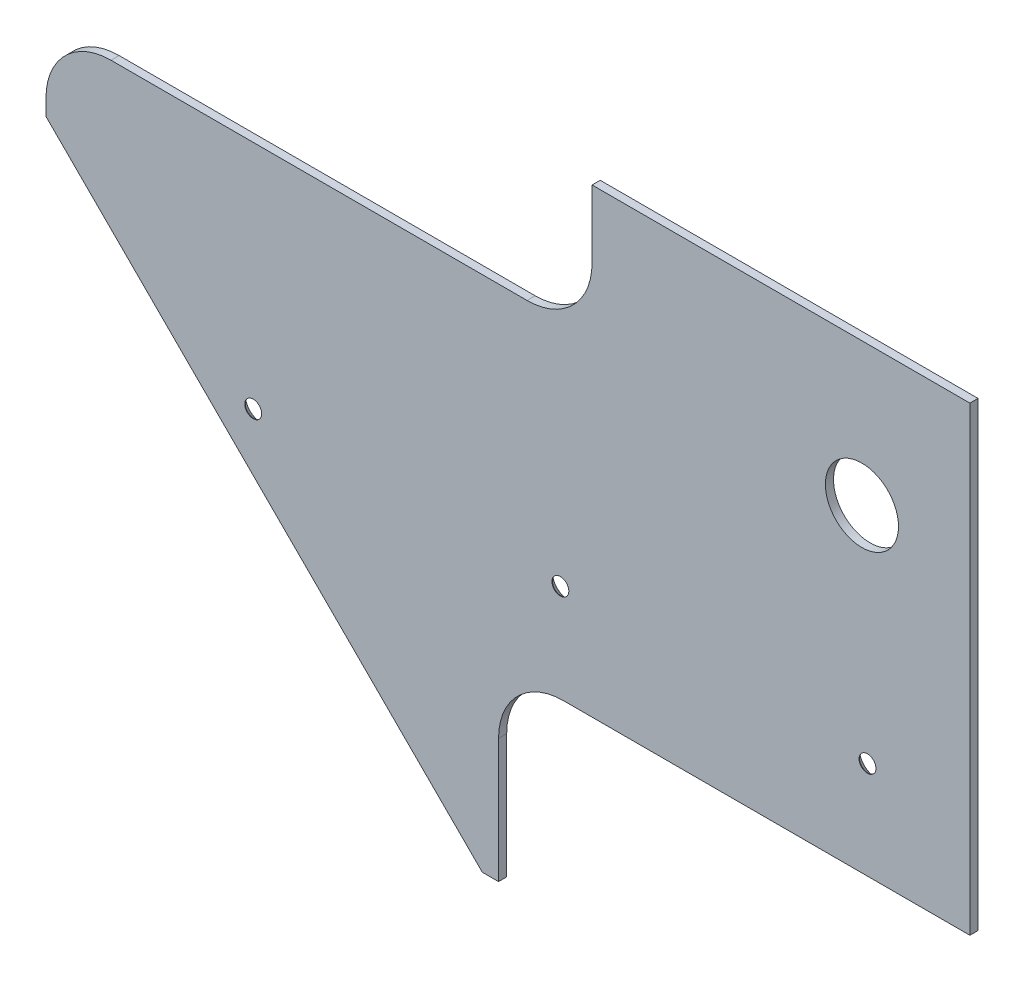
from build123d import *

# Parameters (mm, degrees)
SKETCH1_R                                      = 14.2875
BOSS_EXTRUDE1_DEPTH                            = 3.175
SKETCH2_W                                      = 184.202806358
SKETCH2_H                                      = 73.914
CUT_EXTRUDE1_DEPTH                             = 266.893552722
FILLET1_R                                      = 25.4
SKETCH4_W                                      = 213.36
SKETCH4_H                                      = 64.479988722
CUT_EXTRUDE2_DEPTH                             = 266.893552722
FILLET2_R                                      = 25.4
SKETCH7_W                                      = 147.610011278
SKETCH7_H                                      = 12.7
CUT_EXTRUDE4_DEPTH                             = 266.893552722
CSK_FOR_M6_FLAT_HEAD_MACHINE_SCREW1_AT_2_COUNT = 2
CSK_FOR_M6_FLAT_HEAD_MACHINE_SCREW1_AT_2_PITCH = 120
CSK_FOR_M6_FLAT_HEAD_MACHINE_SCREW1_AT_3_COUNT = 2
CSK_FOR_M6_FLAT_HEAD_MACHINE_SCREW1_AT_3_PITCH = 240


with BuildPart() as part:
    # Sketch1 → Boss-Extrude1 (new body)
    with BuildSketch(Plane.XY):
        Polygon((-138.259383474, 48.991487021), (32.210627804, -121.478524257), (222.710627804, -121.478524257), (222.710627804, 145.221475743), (-138.259383474, 145.221475743), align=None)
        with Locations((180.538014078, 76.831975743)):
            Circle(SKETCH1_R, mode=Mode.SUBTRACT)
    extrude(amount=BOSS_EXTRUDE1_DEPTH)

    # Sketch2 → Cut-Extrude1 (cut, through all)
    with BuildSketch(Plane.XY.offset(3.175)):
        with Locations((130.662030983, -84.521524257)):
            Rectangle(SKETCH2_W, SKETCH2_H)
    extrude(amount=-CUT_EXTRUDE1_DEPTH, mode=Mode.SUBTRACT)

    # Fillet1
    fillet1_edges = [part.edges().sort_by_distance(p)[0] for p in [
        (38.560627804, -47.564524257, 1.5875),
    ]]
    fillet(fillet1_edges, radius=FILLET1_R)

    # Sketch4 → Cut-Extrude2 (cut, through all)
    with BuildSketch(Plane.XY.offset(3.175)):
        with Locations((-31.579383474, 112.981481382)):
            Rectangle(SKETCH4_W, SKETCH4_H)
    extrude(amount=-CUT_EXTRUDE2_DEPTH, mode=Mode.SUBTRACT)

    # Fillet2
    fillet2_edges = [part.edges().sort_by_distance(p)[0] for p in [
        (-138.259383474, 80.741487021, 1.5875),
        (75.100616526, 80.741487021, 1.5875),
    ]]
    fillet(fillet2_edges, radius=FILLET2_R)

    # Sketch7 → Cut-Extrude4 (cut, through all)
    with BuildSketch(Plane.XY.offset(3.175)):
        with Locations((148.905622165, 138.871475743)):
            Rectangle(SKETCH7_W, SKETCH7_H)
    extrude(amount=-CUT_EXTRUDE4_DEPTH, mode=Mode.SUBTRACT)

    # Sketch8 → CSK for M6 Flat Head Machine Screw1 (revolve, cut)
    with BuildSketch(Plane(origin=(182.710627794, -9.464524257, 0), x_dir=(0, 1, 0), z_dir=(1, 0, 0))):
        Polygon((0, 0), (0, 3.175), (3.3, 3.175), (3.3, 3), (6.3, 0), align=None)
    csk_for_m6_flat_head_machine_screw1 = revolve(axis=Axis((182.710627794, -9.464524257, -6.35), (0, 0, 1)), mode=Mode.SUBTRACT)

    # CSK for M6 Flat Head Machine Screw1 at 2: CSK for M6 Flat Head Machine Screw1 ×2
    with Locations(*[(-i * CSK_FOR_M6_FLAT_HEAD_MACHINE_SCREW1_AT_2_PITCH, 0, 0) for i in range(1, CSK_FOR_M6_FLAT_HEAD_MACHINE_SCREW1_AT_2_COUNT)]):
        add(csk_for_m6_flat_head_machine_screw1, mode=Mode.SUBTRACT)

    # CSK for M6 Flat Head Machine Screw1 at 3: CSK for M6 Flat Head Machine Screw1 ×2
    with Locations(*[(-i * CSK_FOR_M6_FLAT_HEAD_MACHINE_SCREW1_AT_3_PITCH, 0, 0) for i in range(1, CSK_FOR_M6_FLAT_HEAD_MACHINE_SCREW1_AT_3_COUNT)]):
        add(csk_for_m6_flat_head_machine_screw1, mode=Mode.SUBTRACT)


solid = part.part
